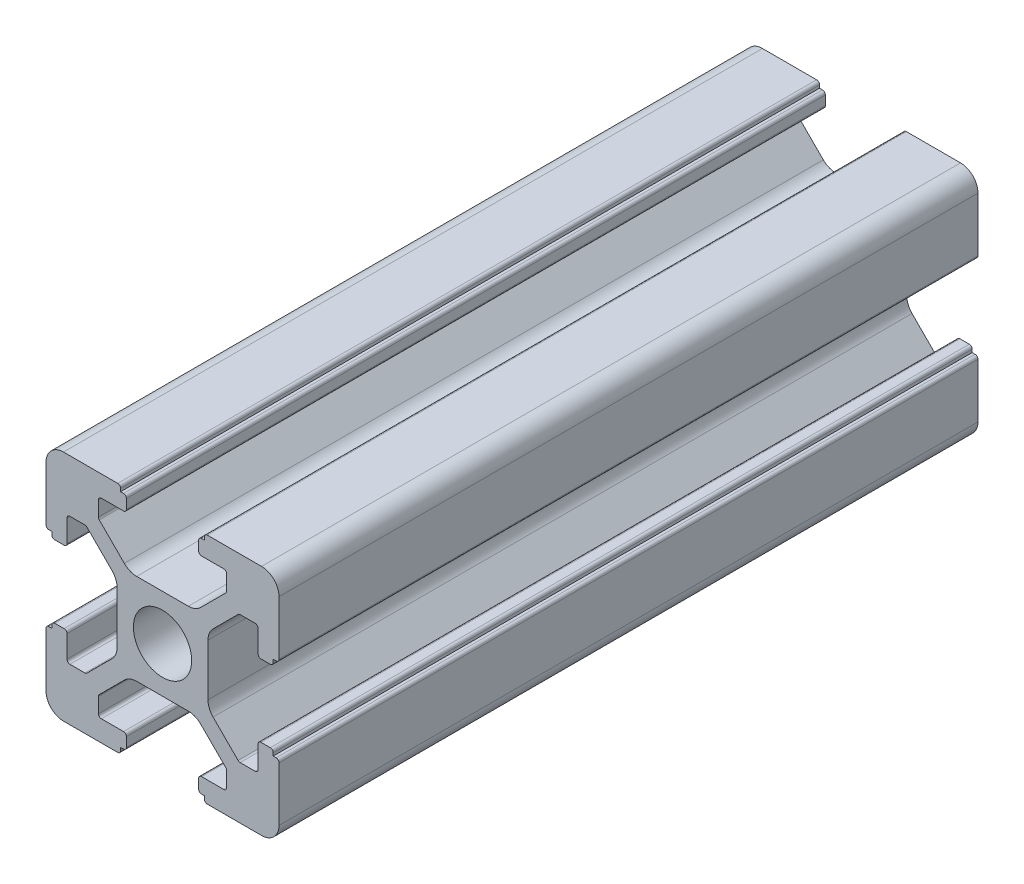
from build123d import *

# Parameters (mm, degrees)
SKETCH_1_R      = 2.5
EXTRUDE_1_DEPTH = 60


with BuildPart() as part:
    # 草图1 → 凸台-拉伸1 (new body)
    with BuildSketch(Plane.XY):
        with BuildLine():
            ThreePointArc((-10.002261885, -8.502261885), (-9.562922057, -9.562922057), (-8.502261885, -10.002261885))
            Line((-8.502261885, -10.002261885), (-3.85, -10.002261885))
            ThreePointArc((-3.85, -10.002261885), (-3.673223305, -9.929038581), (-3.6, -9.752261885))
            Line((-3.6, -9.752261885), (-3.6, -9.502261885))
            Line((-3.6, -9.502261885), (-3.35, -9.502261885))
            ThreePointArc((-3.35, -9.502261885), (-3.173223305, -9.429038581), (-3.1, -9.252261885))
            Line((-3.1, -9.252261885), (-3.1, -8.45))
            ThreePointArc((-3.1, -8.45), (-3.173223305, -8.273223305), (-3.35, -8.2))
            Line((-3.35, -8.2), (-5.25, -8.2))
            ThreePointArc((-5.25, -8.2), (-5.426776695, -8.126776695), (-5.5, -7.95))
            Line((-5.5, -7.95), (-5.5, -6.664213562))
            ThreePointArc((-5.5, -6.664213562), (-5.480969883, -6.568542704), (-5.426776695, -6.487436867))
            Line((-5.426776695, -6.487436867), (-3.278679656, -4.339339828))
            ThreePointArc((-3.278679656, -4.339339828), (-2.792044633, -4.014180701), (-2.218019485, -3.9))
            Line((-2.218019485, -3.9), (2.218019485, -3.9))
            ThreePointArc((2.218019485, -3.9), (2.792044633, -4.014180701), (3.278679656, -4.339339828))
            Line((3.278679656, -4.339339828), (5.426776695, -6.487436867))
            ThreePointArc((5.426776695, -6.487436867), (5.480969883, -6.568542704), (5.5, -6.664213562))
            Line((5.5, -6.664213562), (5.5, -7.95))
            ThreePointArc((5.5, -7.95), (5.426776695, -8.126776695), (5.25, -8.2))
            Line((5.25, -8.2), (3.35, -8.2))
            ThreePointArc((3.35, -8.2), (3.173223305, -8.273223305), (3.1, -8.45))
            Line((3.1, -8.45), (3.1, -9.252261885))
            ThreePointArc((3.1, -9.252261885), (3.173223305, -9.429038581), (3.35, -9.502261885))
            Line((3.35, -9.502261885), (3.6, -9.502261885))
            Line((3.6, -9.502261885), (3.6, -9.752261885))
            ThreePointArc((3.6, -9.752261885), (3.673223305, -9.929038581), (3.85, -10.002261885))
            Line((3.85, -10.002261885), (8.502261885, -10.002261885))
            ThreePointArc((8.502261885, -10.002261885), (9.562922057, -9.562922057), (10.002261885, -8.502261885))
            Line((10.002261885, -8.502261885), (10.002261885, -3.85))
            ThreePointArc((10.002261885, -3.85), (9.929038581, -3.673223305), (9.752261885, -3.6))
            Line((9.752261885, -3.6), (9.502261885, -3.6))
            Line((9.502261885, -3.6), (9.502261885, -3.35))
            ThreePointArc((9.502261885, -3.35), (9.429038581, -3.173223305), (9.252261885, -3.1))
            Line((9.252261885, -3.1), (8.45, -3.1))
            ThreePointArc((8.45, -3.1), (8.273223305, -3.173223305), (8.2, -3.35))
            Line((8.2, -3.35), (8.2, -5.25))
            ThreePointArc((8.2, -5.25), (8.126776695, -5.426776695), (7.95, -5.5))
            Line((7.95, -5.5), (6.664213562, -5.5))
            ThreePointArc((6.664213562, -5.5), (6.568542704, -5.480969883), (6.487436867, -5.426776695))
            Line((6.487436867, -5.426776695), (4.339339828, -3.278679656))
            ThreePointArc((4.339339828, -3.278679656), (4.014180701, -2.792044633), (3.9, -2.218019485))
            Line((3.9, -2.218019485), (3.9, 2.218019485))
            ThreePointArc((3.9, 2.218019485), (4.014180701, 2.792044633), (4.339339828, 3.278679656))
            Line((4.339339828, 3.278679656), (6.487436867, 5.426776695))
            ThreePointArc((6.487436867, 5.426776695), (6.568542704, 5.480969883), (6.664213562, 5.5))
            Line((6.664213562, 5.5), (7.95, 5.5))
            ThreePointArc((7.95, 5.5), (8.126776695, 5.426776695), (8.2, 5.25))
            Line((8.2, 5.25), (8.2, 3.35))
            ThreePointArc((8.2, 3.35), (8.273223305, 3.173223305), (8.45, 3.1))
            Line((8.45, 3.1), (9.252261885, 3.1))
            ThreePointArc((9.252261885, 3.1), (9.429038581, 3.173223305), (9.502261885, 3.35))
            Line((9.502261885, 3.35), (9.502261885, 3.6))
            Line((9.502261885, 3.6), (9.752261885, 3.6))
            ThreePointArc((9.752261885, 3.6), (9.929038581, 3.673223305), (10.002261885, 3.85))
            Line((10.002261885, 3.85), (10.002261885, 8.502261885))
            ThreePointArc((10.002261885, 8.502261885), (9.562922057, 9.562922057), (8.502261885, 10.002261885))
            Line((8.502261885, 10.002261885), (3.85, 10.002261885))
            ThreePointArc((3.85, 10.002261885), (3.673223305, 9.929038581), (3.6, 9.752261885))
            Line((3.6, 9.752261885), (3.6, 9.502261885))
            Line((3.6, 9.502261885), (3.35, 9.502261885))
            ThreePointArc((3.35, 9.502261885), (3.173223305, 9.429038581), (3.1, 9.252261885))
            Line((3.1, 9.252261885), (3.1, 8.45))
            ThreePointArc((3.1, 8.45), (3.173223305, 8.273223305), (3.35, 8.2))
            Line((3.35, 8.2), (5.25, 8.2))
            ThreePointArc((5.25, 8.2), (5.426776695, 8.126776695), (5.5, 7.95))
            Line((5.5, 7.95), (5.5, 6.664213562))
            ThreePointArc((5.5, 6.664213562), (5.480969883, 6.568542704), (5.426776695, 6.487436867))
            Line((5.426776695, 6.487436867), (3.278679656, 4.339339828))
            ThreePointArc((3.278679656, 4.339339828), (2.792044633, 4.014180701), (2.218019485, 3.9))
            Line((2.218019485, 3.9), (-2.218019485, 3.9))
            ThreePointArc((-2.218019485, 3.9), (-2.792044633, 4.014180701), (-3.278679656, 4.339339828))
            Line((-3.278679656, 4.339339828), (-5.426776695, 6.487436867))
            ThreePointArc((-5.426776695, 6.487436867), (-5.480969883, 6.568542704), (-5.5, 6.664213562))
            Line((-5.5, 6.664213562), (-5.5, 7.95))
            ThreePointArc((-5.5, 7.95), (-5.426776695, 8.126776695), (-5.25, 8.2))
            Line((-5.25, 8.2), (-3.35, 8.2))
            ThreePointArc((-3.35, 8.2), (-3.173223305, 8.273223305), (-3.1, 8.45))
            Line((-3.1, 8.45), (-3.1, 9.252261885))
            ThreePointArc((-3.1, 9.252261885), (-3.173223305, 9.429038581), (-3.35, 9.502261885))
            Line((-3.35, 9.502261885), (-3.6, 9.502261885))
            Line((-3.6, 9.502261885), (-3.6, 9.752261885))
            ThreePointArc((-3.6, 9.752261885), (-3.673223305, 9.929038581), (-3.85, 10.002261885))
            Line((-3.85, 10.002261885), (-8.502261885, 10.002261885))
            ThreePointArc((-8.502261885, 10.002261885), (-9.562922057, 9.562922057), (-10.002261885, 8.502261885))
            Line((-10.002261885, 8.502261885), (-10.002261885, 3.85))
            ThreePointArc((-10.002261885, 3.85), (-9.929038581, 3.673223305), (-9.752261885, 3.6))
            Line((-9.752261885, 3.6), (-9.502261885, 3.6))
            Line((-9.502261885, 3.6), (-9.502261885, 3.35))
            ThreePointArc((-9.502261885, 3.35), (-9.429038581, 3.173223305), (-9.252261885, 3.1))
            Line((-9.252261885, 3.1), (-8.45, 3.1))
            ThreePointArc((-8.45, 3.1), (-8.273223305, 3.173223305), (-8.2, 3.35))
            Line((-8.2, 3.35), (-8.2, 5.25))
            ThreePointArc((-8.2, 5.25), (-8.126776695, 5.426776695), (-7.95, 5.5))
            Line((-7.95, 5.5), (-6.664213562, 5.5))
            ThreePointArc((-6.664213562, 5.5), (-6.568542704, 5.480969883), (-6.487436867, 5.426776695))
            Line((-6.487436867, 5.426776695), (-4.339339828, 3.278679656))
            ThreePointArc((-4.339339828, 3.278679656), (-4.014180701, 2.792044633), (-3.9, 2.218019485))
            Line((-3.9, 2.218019485), (-3.9, -2.218019485))
            ThreePointArc((-3.9, -2.218019485), (-4.014180701, -2.792044633), (-4.339339828, -3.278679656))
            Line((-4.339339828, -3.278679656), (-6.487436867, -5.426776695))
            ThreePointArc((-6.487436867, -5.426776695), (-6.568542704, -5.480969883), (-6.664213562, -5.5))
            Line((-6.664213562, -5.5), (-7.95, -5.5))
            ThreePointArc((-7.95, -5.5), (-8.126776695, -5.426776695), (-8.2, -5.25))
            Line((-8.2, -5.25), (-8.2, -3.35))
            ThreePointArc((-8.2, -3.35), (-8.273223305, -3.173223305), (-8.45, -3.1))
            Line((-8.45, -3.1), (-9.252261885, -3.1))
            ThreePointArc((-9.252261885, -3.1), (-9.429038581, -3.173223305), (-9.502261885, -3.35))
            Line((-9.502261885, -3.35), (-9.502261885, -3.6))
            Line((-9.502261885, -3.6), (-9.752261885, -3.6))
            ThreePointArc((-9.752261885, -3.6), (-9.929038581, -3.673223305), (-10.002261885, -3.85))
            Line((-10.002261885, -3.85), (-10.002261885, -8.502261885))
        make_face()
        Circle(SKETCH_1_R, mode=Mode.SUBTRACT)
    extrude(amount=EXTRUDE_1_DEPTH)


solid = part.part
